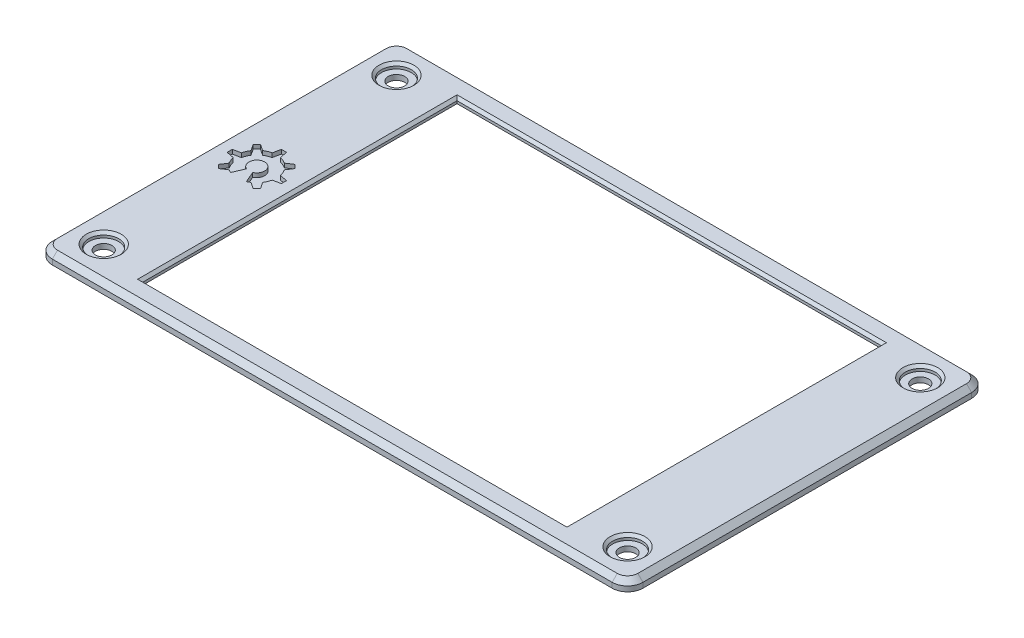
from build123d import *

# Parameters (mm, degrees)
SKETCH1_R           = 1.6
SKETCH1_W           = 82.6
SKETCH1_H           = 61.2
BOSS_EXTRUDE1_DEPTH = 2
SKETCH2_W           = 84.6
SKETCH2_H           = 63.2
CUT_EXTRUDE1_DEPTH  = 1
CHAMFER1_SIZE       = 0.5
SKETCH3_R           = 2.9
CUT_EXTRUDE2_DEPTH  = 1
CHAMFER2_SIZE       = 0.5
CHAMFER3_SIZE       = 1
CUT_EXTRUDE3_DEPTH  = 0.8


with BuildPart() as part:
    # Sketch1 → Boss-Extrude1 (new body)
    with BuildSketch(Plane(origin=(0, 0, 0), x_dir=(1, 0, 0), z_dir=(0, 1, 0))):
        with BuildLine():
            Line((3, 0), (112, 0))
            ThreePointArc((112, 0), (114.121320344, 0.878679656), (115, 3))
            Line((115, 3), (115, 67))
            ThreePointArc((115, 67), (114.121320344, 69.121320344), (112, 70))
            Line((112, 70), (3, 70))
            ThreePointArc((3, 70), (0.878679656, 69.121320344), (0, 67))
            Line((0, 67), (0, 3))
            ThreePointArc((0, 3), (0.878679656, 0.878679656), (3, 0))
        make_face()
        with Locations((6.5, 63.5)):
            Circle(SKETCH1_R, mode=Mode.SUBTRACT)
        with Locations((6.5, 6.5)):
            Circle(SKETCH1_R, mode=Mode.SUBTRACT)
        with Locations((108.5, 6.5)):
            Circle(SKETCH1_R, mode=Mode.SUBTRACT)
        with Locations((108.5, 63.5)):
            Circle(SKETCH1_R, mode=Mode.SUBTRACT)
        with Locations((57.5, 35)):
            Rectangle(SKETCH1_W, SKETCH1_H, mode=Mode.SUBTRACT)
    extrude(amount=BOSS_EXTRUDE1_DEPTH)

    # Sketch2 → Cut-Extrude1 (cut)
    with BuildSketch(Plane.XZ):
        with Locations((57.5, -35)):
            Rectangle(SKETCH2_W, SKETCH2_H)
    extrude(amount=-CUT_EXTRUDE1_DEPTH, mode=Mode.SUBTRACT)

    # Chamfer1
    chamfer1_edges = [part.edges().sort_by_distance(p)[0] for p in [
        (98.8, 2, -35),
        (57.5, 2, -65.6),
        (16.2, 2, -35),
        (57.5, 2, -4.4),
    ]]
    chamfer(chamfer1_edges, length=CHAMFER1_SIZE)

    # Sketch3 → Cut-Extrude2 (cut)
    with BuildSketch(Plane(origin=(0, 2, 0), x_dir=(1, 0, 0), z_dir=(0, 1, 0))):
        with Locations((6.5, 63.5)):
            Circle(SKETCH3_R)
        with Locations((108.5, 63.5)):
            Circle(SKETCH3_R)
        with Locations((108.5, 6.5)):
            Circle(SKETCH3_R)
        with Locations((6.5, 6.5)):
            Circle(SKETCH3_R)
    extrude(amount=-CUT_EXTRUDE2_DEPTH, mode=Mode.SUBTRACT)

    # Chamfer2
    chamfer2_edges = [part.edges().sort_by_distance(p)[0] for p in [
        (105.6, 2, -6.5),
        (105.6, 2, -63.5),
        (3.6, 2, -6.5),
        (3.6, 2, -63.5),
    ]]
    chamfer(chamfer2_edges, length=CHAMFER2_SIZE)

    # Chamfer3
    chamfer3_edges = [part.edges().sort_by_distance(p)[0] for p in [
        (114.121320344, 2, -0.878679656),
        (115, 2, -35),
        (114.121320344, 2, -69.121320344),
        (57.5, 2, -70),
        (0.878679656, 2, -69.121320344),
        (0, 2, -35),
        (0.878679656, 2, -0.878679656),
        (57.5, 2, 0),
    ]]
    chamfer(chamfer3_edges, length=CHAMFER3_SIZE)

    # Sketch4 → Cut-Extrude3 (cut)
    with BuildSketch(Plane(origin=(0, 2, 0), x_dir=(1, 0, 0), z_dir=(0, 1, 0))):
        with BuildLine():
            Line((9.825395701, 30.960299483), (8.89586377, 33.118648479))
            ThreePointArc((8.89586377, 33.118648479), (8.290679151, 36.053871442), (7.685494532, 33.118648479))
            Line((7.685494532, 33.118648479), (6.755962601, 30.960299483))
            ThreePointArc((6.755962601, 30.960299483), (6.457149652, 31.104431492), (6.171741697, 31.273563139))
            Line((6.171741697, 31.273563139), (4.91328092, 30.43936643))
            Line((4.91328092, 30.43936643), (4.55972753, 30.792919821))
            Line((4.55972753, 30.792919821), (4.206174139, 31.146473212))
            Line((4.206174139, 31.146473212), (5.040370847, 32.404933989))
            ThreePointArc((5.040370847, 32.404933989), (4.706026565, 33.039059725), (4.494049066, 33.723871442))
            Line((4.494049066, 33.723871442), (3.014316768, 34.023871442))
            Line((3.014316768, 34.023871442), (3.014316768, 34.523871442))
            Line((3.014316768, 34.523871442), (3.014316768, 35.023871442))
            Line((3.014316768, 35.023871442), (4.494049066, 35.323871442))
            ThreePointArc((4.494049066, 35.323871442), (4.706026565, 36.00868316), (5.040370847, 36.642808896))
            Line((5.040370847, 36.642808896), (4.206174139, 37.901269673))
            Line((4.206174139, 37.901269673), (4.55972753, 38.254823064))
            Line((4.55972753, 38.254823064), (4.91328092, 38.608376454))
            Line((4.91328092, 38.608376454), (6.171741697, 37.774179746))
            ThreePointArc((6.171741697, 37.774179746), (6.805867433, 38.108524028), (7.490679151, 38.320501527))
            Line((7.490679151, 38.320501527), (7.790679151, 39.800233826))
            Line((7.790679151, 39.800233826), (8.290679151, 39.800233826))
            Line((8.290679151, 39.800233826), (8.790679151, 39.800233826))
            Line((8.790679151, 39.800233826), (9.090679151, 38.320501527))
            ThreePointArc((9.090679151, 38.320501527), (9.775490868, 38.108524028), (10.409616604, 37.774179746))
            Line((10.409616604, 37.774179746), (11.668077381, 38.608376454))
            Line((11.668077381, 38.608376454), (12.021630772, 38.254823064))
            Line((12.021630772, 38.254823064), (12.375184163, 37.901269673))
            Line((12.375184163, 37.901269673), (11.540987454, 36.642808896))
            ThreePointArc((11.540987454, 36.642808896), (11.875331737, 36.00868316), (12.087309236, 35.323871442))
            Line((12.087309236, 35.323871442), (13.567041534, 35.023871442))
            Line((13.567041534, 35.023871442), (13.567041534, 34.523871442))
            Line((13.567041534, 34.523871442), (13.567041534, 34.023871442))
            Line((13.567041534, 34.023871442), (12.087309236, 33.723871442))
            ThreePointArc((12.087309236, 33.723871442), (11.875331737, 33.039059725), (11.540987454, 32.404933989))
            Line((11.540987454, 32.404933989), (12.375184163, 31.146473212))
            Line((12.375184163, 31.146473212), (12.021630772, 30.792919821))
            Line((12.021630772, 30.792919821), (11.668077381, 30.43936643))
            Line((11.668077381, 30.43936643), (10.409616604, 31.273563139))
            ThreePointArc((10.409616604, 31.273563139), (10.12420865, 31.104431492), (9.825395701, 30.960299483))
        make_face()
    extrude(amount=-CUT_EXTRUDE3_DEPTH, mode=Mode.SUBTRACT)


solid = part.part
